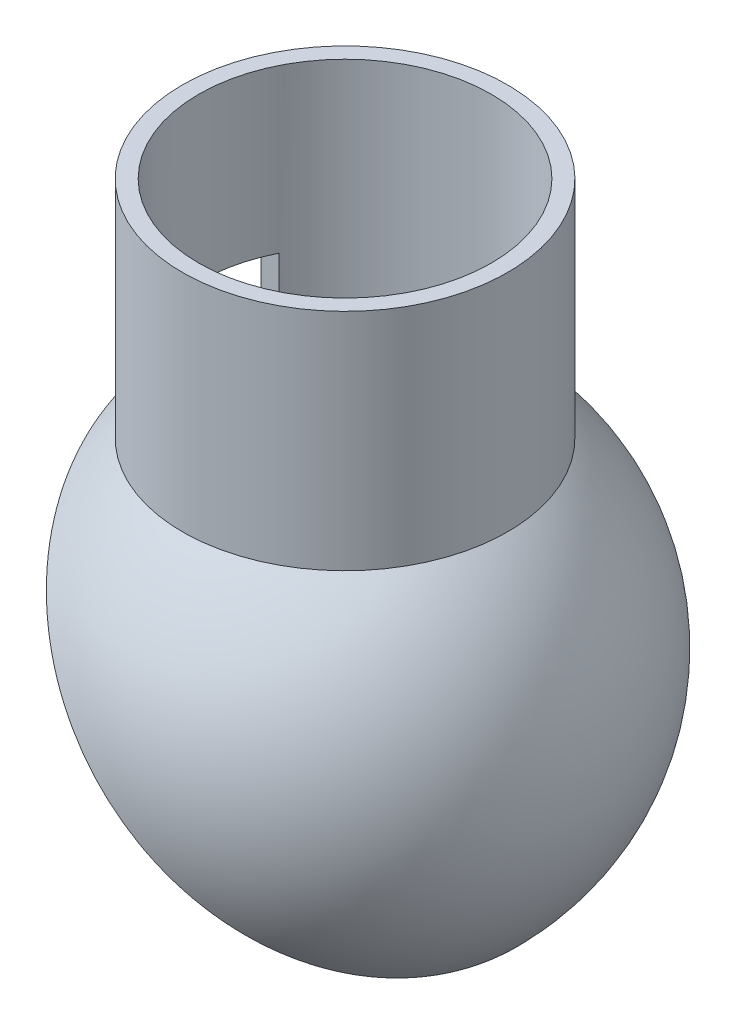
from build123d import *

# Parameters (mm, degrees)
CUT_EXTRUDE_1_DEPTH      = 33.787192622
CUT_EXTRUDE_1_DEPTH_BACK = 33.787192622
SKETCH_5_R               = 9
CUT_EXTRUDE_2_DEPTH      = 15
CUT_EXTRUDE_3_DEPTH      = 14


with BuildPart() as part:
    # 草图1 → 旋转2 (revolve)
    with BuildSketch(Plane.XY):
        with BuildLine():
            Line((0, -15), (0, 25))
            Line((0, 25), (-10, 25))
            Line((-10, 25), (-10, 11.180339887))
            ThreePointArc((-10, 11.180339887), (-14.012585384, -5.352331347), (0, -15))
        make_face()
    revolve(axis=Axis((0, 25, 0), (0, -1, 0)))

    # 草图4 → 切除-拉伸1 (cut, two sides: drawn at the far end of the back side and taken through both)
    with BuildSketch(Plane.XY.offset(-CUT_EXTRUDE_1_DEPTH_BACK)):
        with BuildLine():
            Line((10.606601718, -10.606601718), (0, 0))
            Line((0, 0), (-10.606601718, 10.606601718))
            ThreePointArc((-10.606601718, 10.606601718), (-10.606601718, -10.606601718), (10.606601718, -10.606601718))
        make_face()
    extrude(amount=CUT_EXTRUDE_1_DEPTH + CUT_EXTRUDE_1_DEPTH_BACK, mode=Mode.SUBTRACT)

    # 草图5 → 切除-拉伸2 (cut)
    with BuildSketch(Plane(origin=(0, 25, 0), x_dir=(1, 0, 0), z_dir=(0, 1, 0))):
        Circle(SKETCH_5_R)
    extrude(amount=-CUT_EXTRUDE_2_DEPTH, mode=Mode.SUBTRACT)

    # 草图6 → 切除-拉伸3 (cut)
    with BuildSketch(Plane(origin=(0, 0, 0), x_dir=(0, 0, -1), z_dir=(1, 0, 0))):
        Polygon((0, 12), (4, 12), (4, 15), (-4, 15), (-4, 12), align=None)
    extrude(amount=-CUT_EXTRUDE_3_DEPTH, mode=Mode.SUBTRACT)


solid = part.part
